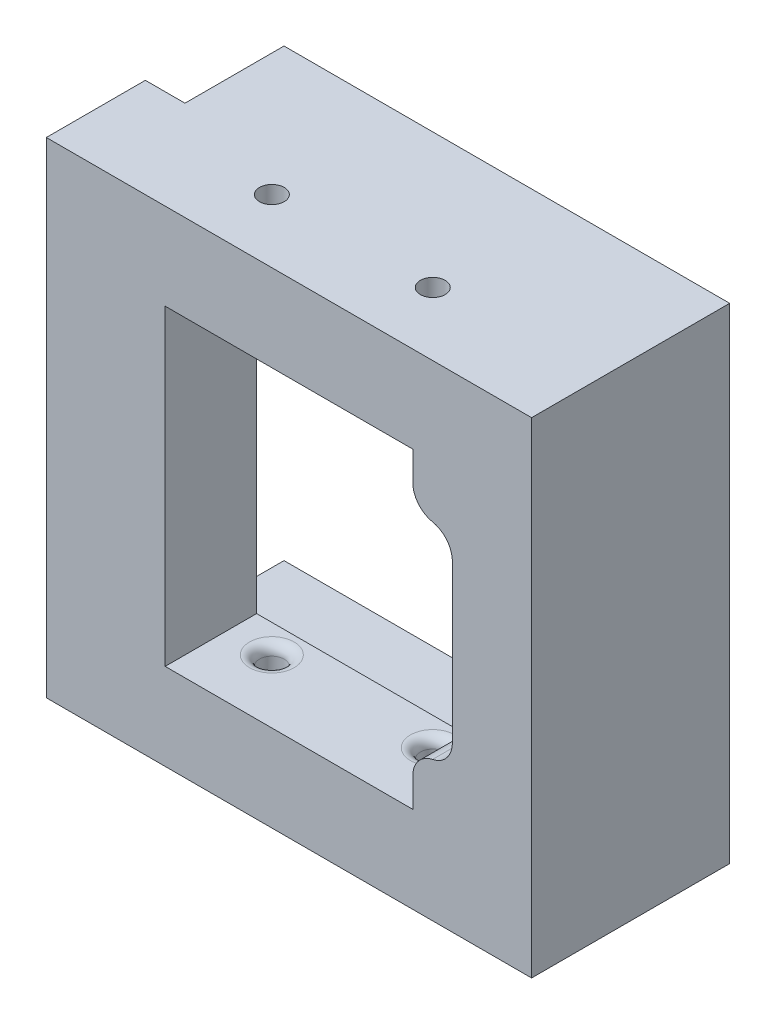
from build123d import *

# Parameters (mm, degrees)
BOSS_EXTRUDE1_START   = -31.115
BOSS_EXTRUDE1_DEPTH   = 62.23
BOSS_EXTRUDE1_2_DEPTH = 5.08
BOSS_EXTRUDE1_START_2 = 26.035
BOSS_EXTRUDE1_3_DEPTH = 5.08
SKETCH2_W             = 13.672898009
SKETCH2_H             = 52.07
CUT_EXTRUDE1_DEPTH    = 52.07
CUT_EXTRUDE3_DEPTH    = 51.80793688


with BuildPart() as part:
    # Boss-Extrude1: read off the stored shape, not the designer's step
    # Boss-Extrude1 outline → Boss-Extrude1 (new body)
    with BuildSketch(Plane(origin=(0, 0, 0), x_dir=(1, 0, 0), z_dir=(0, 1, 0)).offset(BOSS_EXTRUDE1_START)):
        with BuildLine():
            Line((-26.035, 12.7), (-26.035, -0.972898009))
            ThreePointArc((-26.035, -0.972898009), (-26.483762918, -0.272448114), (-27.269759251, 0))
            Line((-27.269759251, 0), (-31.115, 0))
            Line((-31.115, 0), (-31.115, -12.7))
            Line((-31.115, -12.7), (31.115, -12.7))
            Line((31.115, -12.7), (31.115, 12.7))
            Line((31.115, 12.7), (-26.035, 12.7))
        make_face()
    extrude(amount=BOSS_EXTRUDE1_DEPTH)

    # Boss-Extrude1 2 outline → Boss-Extrude1 2 (add)
    with BuildSketch(Plane(origin=(0, 0, 0), x_dir=(1, 0, 0), z_dir=(0, 1, 0)).offset(BOSS_EXTRUDE1_START)):
        with BuildLine():
            Line((-26.035, -0.972898009), (-26.035, 0))
            Line((-26.035, 0), (-27.269759251, 0))
            ThreePointArc((-27.269759251, 0), (-26.483762918, -0.272448114), (-26.035, -0.972898009))
        make_face()
    extrude(amount=BOSS_EXTRUDE1_2_DEPTH)

    # Boss-Extrude1 3 outline → Boss-Extrude1 3 (add)
    with BuildSketch(Plane(origin=(0, 0, 0), x_dir=(1, 0, 0), z_dir=(0, 1, 0)).offset(BOSS_EXTRUDE1_START_2)):
        with BuildLine():
            Line((-26.035, -0.972898009), (-26.035, 0))
            Line((-26.035, 0), (-27.269759251, 0))
            ThreePointArc((-27.269759251, 0), (-26.483762918, -0.272448114), (-26.035, -0.972898009))
        make_face()
    extrude(amount=BOSS_EXTRUDE1_3_DEPTH)

    # Sketch2 → Cut-Extrude1 (cut)
    with BuildSketch(Plane.ZY.offset(26.035)):
        with Locations((-5.863550996, 0)):
            Rectangle(SKETCH2_W, SKETCH2_H)
    extrude(amount=-CUT_EXTRUDE1_DEPTH, mode=Mode.SUBTRACT)

    # Sketch4 → Cut-Extrude3 (cut, through all)
    with BuildSketch(Plane.XY.offset(12.7)):
        with BuildLine():
            Line((15.875, 16.302284846), (15.875, 20.0025))
            Line((15.875, 20.0025), (-15.875, 20.0025))
            Line((-15.875, 20.0025), (-15.875, -20.0025))
            Line((-15.875, -20.0025), (15.875, -20.0025))
            Line((15.875, -20.0025), (15.875, -16.302284846))
            ThreePointArc((15.875, -16.302284846), (16.590655575, -14.294238532), (18.415, -13.191432873))
            ThreePointArc((18.415, -13.191432873), (20.239344425, -12.088627214), (20.955, -10.0805809))
            Line((20.955, -10.0805809), (20.955, 10.0805809))
            ThreePointArc((20.955, 10.0805809), (20.239344425, 12.088627214), (18.415, 13.191432873))
            ThreePointArc((18.415, 13.191432873), (16.590655575, 14.294238532), (15.875, 16.302284846))
        make_face()
    extrude(amount=-CUT_EXTRUDE3_DEPTH, mode=Mode.SUBTRACT)

    # Sketch5 → Cut-Revolve1 (revolve, cut)
    with BuildSketch(Plane(origin=(0, 0, 4.578168392), x_dir=(-1, 0, 0), z_dir=(0, 0, -1)), mode=Mode.PRIVATE) as cut_revolve1_sk:
        with BuildLine():
            Line((8.730963547, -31.115), (10.318463547, -31.115))
            Line((10.318463547, -31.115), (10.318463547, -20.0025))
            Line((10.318463547, -20.0025), (7.460963547, -20.0025))
            ThreePointArc((7.460963547, -20.0025), (8.358989159, -20.374474388), (8.730963547, -21.2725))
            Line((8.730963547, -21.2725), (8.730963547, -31.115))
        make_face()
    revolve(cut_revolve1_sk.sketch.rotate(Axis((-10.318463547, -31.115, 4.578168392), (0, 1, 0)), 270), axis=Axis((-10.318463547, -31.115, 4.578168392), (0, 1, 0)), mode=Mode.SUBTRACT)

    # Sketch6 → Cut-Revolve2 (revolve, cut)
    with BuildSketch(Plane(origin=(0, 0, 4.578168392), x_dir=(-1, 0, 0), z_dir=(0, 0, -1)), mode=Mode.PRIVATE) as cut_revolve2_sk:
        with BuildLine():
            Line((-11.905963547, -31.115), (-10.318463547, -31.115))
            Line((-10.318463547, -31.115), (-10.318463547, -20.0025))
            Line((-10.318463547, -20.0025), (-13.175963547, -20.0025))
            ThreePointArc((-13.175963547, -20.0025), (-12.277937935, -20.374474388), (-11.905963547, -21.2725))
            Line((-11.905963547, -21.2725), (-11.905963547, -31.115))
        make_face()
    revolve(cut_revolve2_sk.sketch.rotate(Axis((10.318463547, -31.115, 4.578168392), (0, 1, 0)), 180), axis=Axis((10.318463547, -31.115, 4.578168392), (0, 1, 0)), mode=Mode.SUBTRACT)

    # Sketch7 → Cut-Revolve3 (revolve, cut)
    with BuildSketch(Plane(origin=(0, 0, 4.578168392), x_dir=(-1, 0, 0), z_dir=(0, 0, -1)), mode=Mode.PRIVATE) as cut_revolve3_sk:
        with BuildLine():
            Line((7.460963547, 20.0025), (10.318463547, 20.0025))
            Line((10.318463547, 20.0025), (10.318463547, 31.115))
            Line((10.318463547, 31.115), (8.730963547, 31.115))
            Line((8.730963547, 31.115), (8.730963547, 21.2725))
            ThreePointArc((8.730963547, 21.2725), (8.358989159, 20.374474388), (7.460963547, 20.0025))
        make_face()
    revolve(cut_revolve3_sk.sketch.rotate(Axis((-10.318463547, 20.0025, 4.578168392), (0, 1, 0)), 180), axis=Axis((-10.318463547, 20.0025, 4.578168392), (0, 1, 0)), mode=Mode.SUBTRACT)

    # Sketch8 → Cut-Revolve4 (revolve, cut)
    with BuildSketch(Plane(origin=(0, 0, 4.578168392), x_dir=(-1, 0, 0), z_dir=(0, 0, -1)), mode=Mode.PRIVATE) as cut_revolve4_sk:
        with BuildLine():
            Line((-13.175963547, 20.0025), (-10.318463547, 20.0025))
            Line((-10.318463547, 20.0025), (-10.318463547, 31.115))
            Line((-10.318463547, 31.115), (-11.905963547, 31.115))
            Line((-11.905963547, 31.115), (-11.905963547, 21.2725))
            ThreePointArc((-11.905963547, 21.2725), (-12.277937935, 20.374474388), (-13.175963547, 20.0025))
        make_face()
    revolve(cut_revolve4_sk.sketch.rotate(Axis((10.318463547, 20.0025, 4.578168392), (0, 1, 0)), 180), axis=Axis((10.318463547, 20.0025, 4.578168392), (0, 1, 0)), mode=Mode.SUBTRACT)


solid = part.part
